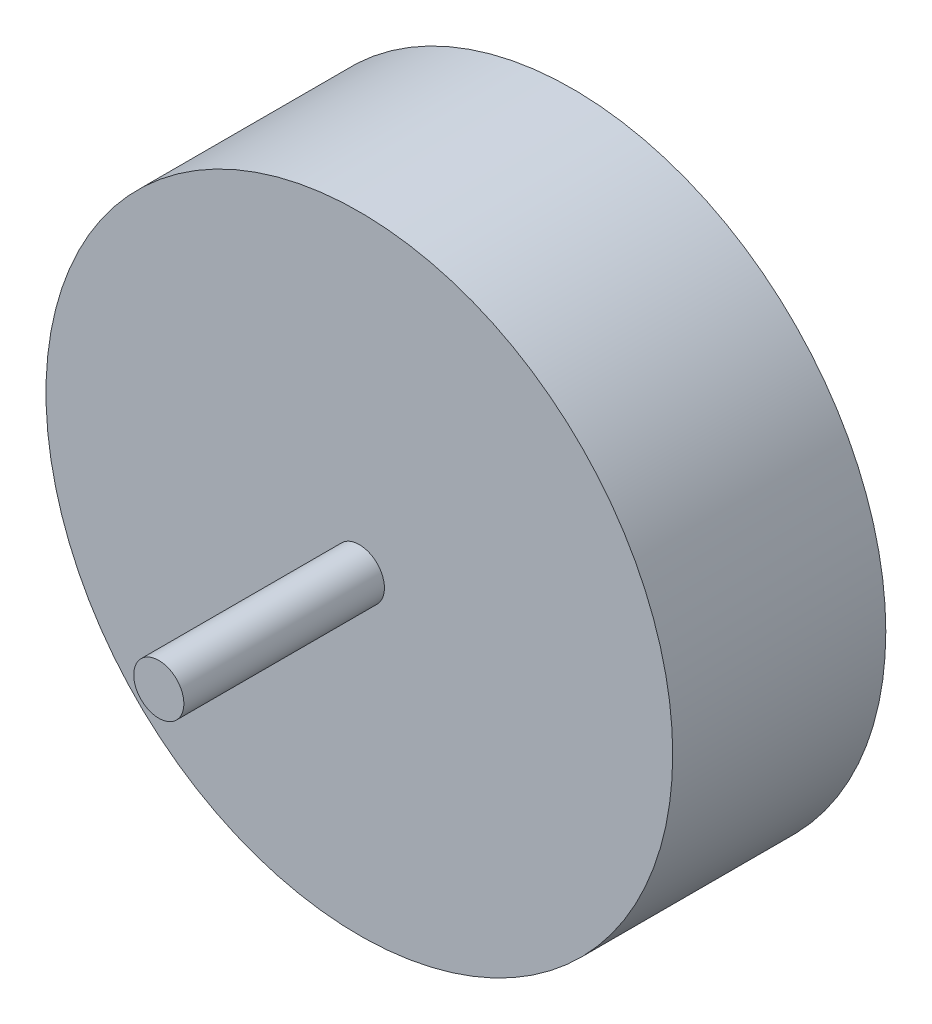
from build123d import *

# Parameters (mm, degrees)
SKETCH1_R           = 25
BOSS_EXTRUDE1_DEPTH = 17
SKETCH2_R           = 2
BOSS_EXTRUDE2_DEPTH = 16


with BuildPart() as part:
    # Sketch1 → Boss-Extrude1 (new body)
    with BuildSketch(Plane.XY):
        Circle(SKETCH1_R)
    extrude(amount=BOSS_EXTRUDE1_DEPTH)

    # Sketch2 → Boss-Extrude2 (add)
    with BuildSketch(Plane.XY.offset(17)):
        Circle(SKETCH2_R)
    extrude(amount=BOSS_EXTRUDE2_DEPTH)


solid = part.part
